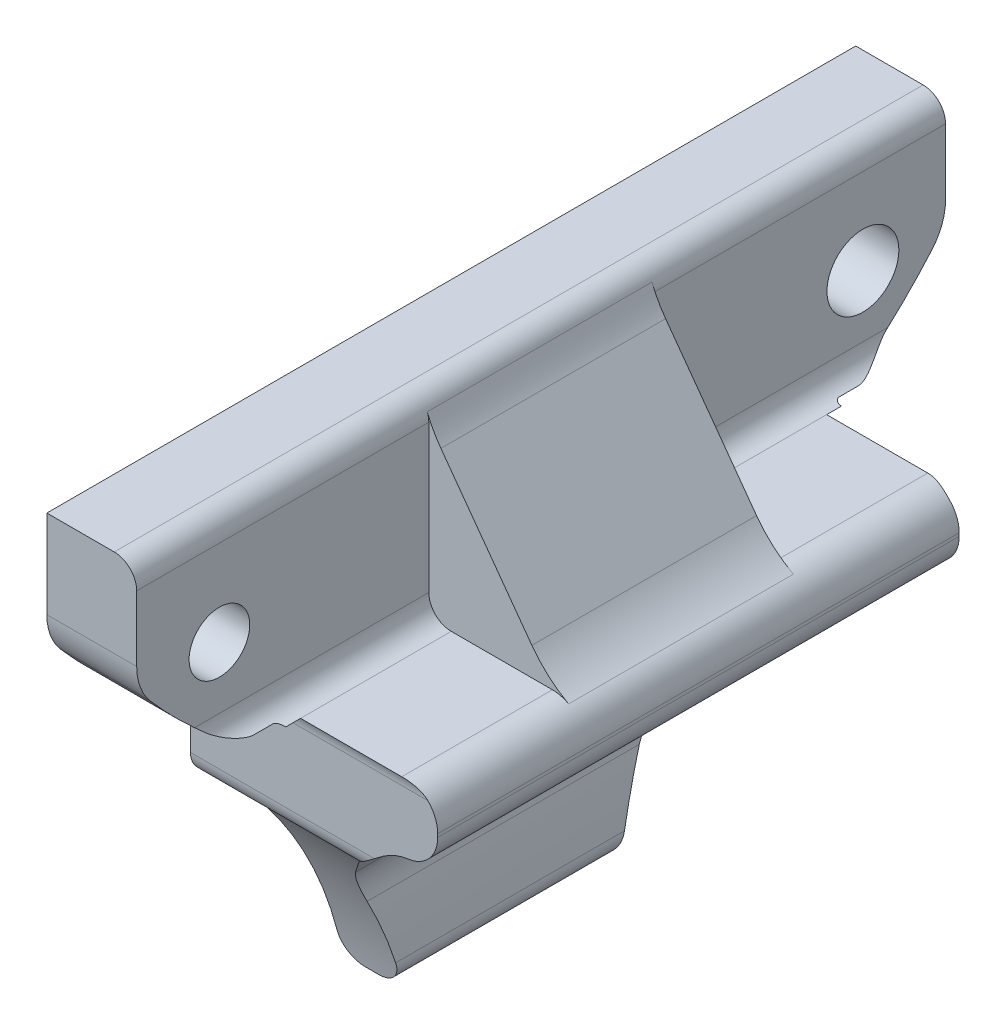
from build123d import *

# Parameters (mm, degrees)
EXTRUDE_1_DEPTH          = 4
EXTRUDE_START            = -4
SKETCH_3_W               = 23.208015554
SKETCH_3_H               = 15.560947598
EXTRUDE_2_DEPTH          = 4
SKETCH_7_W               = 7
SKETCH_7_H               = 15
EXTRUDE_3_DEPTH          = 23.208015554
CUT_EXTRUDE_6_DEPTH      = 25
SKETCH_5_R               = 1.35
SKETCH_5_R_2             = 1.6
CUT_EXTRUDE_2_DEPTH      = 41
FILLET_1_R               = 1
CUT_EXTRUDE_9_DEPTH      = 132.632440775
CUT_EXTRUDE_9_DEPTH_BACK = 132.632440775
SKETCH_16_R              = 17.5
EXTRUDE_5_DEPTH          = 4
FILLET_8_R               = 1
FILLET_10_R              = 1
FILLET_12_R              = 1
FILLET_13_R              = 1.5
RIB_1_REACH              = 137.852
SKETCH_19_WALL_W         = 283.05422189
SKETCH_19_WALL_H         = 10
FILLET_START             = -15.424467696
FILLET_14_DEPTH          = 30.848935392
FILLET_START_2           = -12.604007877
FILLET_14_2_DEPTH        = 25.208015654
FILLET_START_3           = -30.058809371
FILLET_14_3_DEPTH        = 2.058809371
FILLET_15_R              = 5


with BuildPart() as part:
    # 草图2 → 凸台-拉伸1 (new body)
    with BuildSketch(Plane(origin=(-34.058809371, 0, 0), x_dir=(0, 0, -1), z_dir=(1, 0, 0))):
        with BuildLine():
            Line((17.500319827, 130.276008038), (17.500319827, 126.359600173))
            ThreePointArc((17.500319827, 126.359600173), (17.374404969, 125.661169877), (17.012514948, 125.050682332))
            ThreePointArc((17.012514948, 125.050682332), (15.910222403, 123.866105461), (14.725645532, 122.763812916))
            ThreePointArc((14.725645532, 122.763812916), (14.115157987, 122.401922895), (13.416727692, 122.276008038))
            Line((13.416727692, 122.276008038), (8.570604361, 122.276008038))
            Line((8.570604361, 122.276008038), (-4.829395639, 122.276008038))
            Line((-4.829395639, 122.276008038), (-13.416088038, 122.276008038))
            ThreePointArc((-13.416088038, 122.276008038), (-14.114518334, 122.401922895), (-14.725005879, 122.763812916))
            ThreePointArc((-14.725005879, 122.763812916), (-15.90958275, 123.866105461), (-17.011875295, 125.050682332))
            ThreePointArc((-17.011875295, 125.050682332), (-17.373765316, 125.661169877), (-17.499680173, 126.359600173))
            Line((-17.499680173, 126.359600173), (-17.499680173, 130.276008038))
            Line((-17.499680173, 130.276008038), (17.500319827, 130.276008038))
        make_face()
    extrude(amount=EXTRUDE_1_DEPTH)

    # 草图3 → 凸台-拉伸2 (add)
    with BuildSketch(Plane(origin=(-30.058809371, 0, 0), x_dir=(0, 0, -1), z_dir=(1, 0, 0)).offset(EXTRUDE_START)):
        with Locations((0, 114.495534239)):
            Rectangle(SKETCH_3_W, SKETCH_3_H)
    extrude(amount=EXTRUDE_2_DEPTH)

    # 草图7 → 凸台-拉伸3 (add)
    with BuildSketch(Plane.XY.offset(11.604007777)):
        with Locations((-26.558809371, 114.21506044)):
            Rectangle(SKETCH_7_W, SKETCH_7_H)
    extrude(amount=-EXTRUDE_3_DEPTH)

    # 草图11 → 切除-拉伸6 (cut)
    with BuildSketch(Plane.XY.offset(11.604007777)):
        with BuildLine():
            Line((-17.260737948, 105.57071884), (-17.822335609, 118.157865003))
            ThreePointArc((-17.822335609, 118.157865003), (-20.746096987, 118.264862867), (-23.654216554, 118.585284033))
            ThreePointArc((-23.654216554, 118.585284033), (-24.615393694, 118.539747196), (-25.488172243, 118.134540208))
            ThreePointArc((-25.488172243, 118.134540208), (-28.620362377, 115.459397112), (-31.295505473, 112.327206978))
            ThreePointArc((-31.295505473, 112.327206978), (-31.700712461, 111.454428429), (-31.746249298, 110.493251289))
            ThreePointArc((-31.746249298, 110.493251289), (-31.523200675, 108.69967015), (-31.381401894, 106.897844106))
            ThreePointArc((-31.381401894, 106.897844106), (-31.32637065, 105.4380129), (-31.324682737, 103.977145782))
            Line((-31.324682737, 103.977145782), (-17.260737948, 105.57071884))
        make_face()
    extrude(amount=-CUT_EXTRUDE_6_DEPTH, mode=Mode.SUBTRACT)

    # 草图5 → 切除-拉伸2 (cut)
    with BuildSketch(Plane(origin=(-30.058809371, 0, 0), x_dir=(0, 0, -1), z_dir=(1, 0, 0))):
        with Locations(Location((-14.318592493, 125.457095719, 0), (0, 0, 90))):
            Circle(SKETCH_5_R)
        with Locations(Location((14.319232146, 125.457095719, 0), (0, 0, 90))):
            Circle(SKETCH_5_R_2)
    extrude(amount=-CUT_EXTRUDE_2_DEPTH, mode=Mode.SUBTRACT)

    # 圆角1
    fillet_1_edges = [part.edges().sort_by_distance(p)[0] for p in [
        (-32.058809371, 122.276008038, -11.604007777),
    ]]
    fillet(fillet_1_edges, radius=FILLET_1_R)
    fillet_1_2_edges = [part.edges().sort_by_distance(p)[0] for p in [
        (-32.058809371, 122.276008038, 11.604007777),
    ]]
    fillet(fillet_1_2_edges, radius=FILLET_1_R)

    # 草图16 → 切除-拉伸9 (cut, two sides: drawn at the far end of the back side and taken through both)
    with BuildSketch(Plane(origin=(-30.058809371, 0, 0), x_dir=(0, 0, -1), z_dir=(1, 0, 0)).offset(-CUT_EXTRUDE_9_DEPTH_BACK)):
        with Locations((22.000319827, 103.276008038)):
            Circle(SKETCH_16_R)
        with Locations((-21.999680173, 103.276008038)):
            Circle(SKETCH_16_R)
    extrude(amount=CUT_EXTRUDE_9_DEPTH + CUT_EXTRUDE_9_DEPTH_BACK, mode=Mode.SUBTRACT)

    # 草图17 → 凸台-拉伸5 (add)
    with BuildSketch(Plane(origin=(-30.058809371, 0, 0), x_dir=(0, 0, -1), z_dir=(1, 0, 0)).offset(EXTRUDE_START)):
        with BuildLine():
            Line((-12.604007777, 122.276008038), (-13.416088038, 122.276008038))
            ThreePointArc((-13.416088038, 122.276008038), (-14.114518334, 122.401922895), (-14.725005879, 122.763812916))
            ThreePointArc((-14.725005879, 122.763812916), (-15.90958275, 123.866105461), (-17.011875295, 125.050682332))
            ThreePointArc((-17.011875295, 125.050682332), (-17.373765316, 125.661169877), (-17.499680173, 126.359600173))
            Line((-17.499680173, 126.359600173), (-17.499680173, 130.276008038))
            Line((-17.499680173, 130.276008038), (-17.999680173, 130.276008038))
            Line((-17.999680173, 130.276008038), (-17.999680173, 129.776008038))
            Line((-17.999680173, 129.776008038), (-17.999680173, 126.359600173))
            ThreePointArc((-17.999680173, 126.359600173), (-17.842286602, 125.486562303), (-17.389924076, 124.723452872))
            ThreePointArc((-17.389924076, 124.723452872), (-16.263136141, 123.512552071), (-15.052235339, 122.385764135))
            ThreePointArc((-15.052235339, 122.385764135), (-14.289125908, 121.93340161), (-13.416088038, 121.776008038))
            Line((-13.416088038, 121.776008038), (-12.604007777, 121.776008038))
            ThreePointArc((-12.604007777, 121.776008038), (-12.48056994, 121.760531619), (-12.364773606, 121.71506044))
            Line((-12.364773606, 121.71506044), (-11.705546321, 121.71506044))
            ThreePointArc((-11.705546321, 121.71506044), (-12.074410006, 122.124256941), (-12.604007777, 122.276008038))
        make_face()
    extrude_5 = extrude(amount=EXTRUDE_5_DEPTH)

    # 镜向1: 凸台-拉伸5 across plane
    add(extrude_5.mirror(Plane.XY))

    # 圆角8
    fillet_8_edges = [part.edges().sort_by_distance(p)[0] for p in [
        (-30.284407251, 117.353177347, -11.604007777),
        (-30.284113568, 117.353649723, 11.604007777),
    ]]
    fillet(fillet_8_edges, radius=FILLET_8_R)

    # 圆角10
    fillet_10_edges = [part.edges().sort_by_distance(p)[0] for p in [
        (-30.058809371, 130.276008038, 0),
    ]]
    fillet(fillet_10_edges, radius=FILLET_10_R)

    # 圆角12
    fillet_12_edges = [part.edges().sort_by_distance(p)[0] for p in [
        (-31.371585595, 106.71506044, -0.000319827),
        (-34.058809371, 106.71506044, -0.000319827),
    ]]
    fillet(fillet_12_edges, radius=FILLET_12_R)

    # 圆角13
    fillet_13_edges = [part.edges().sort_by_distance(p)[0] for p in [
        (-23.058809371, 121.71506044, 0),
        (-23.058809371, 118.502104481, 0),
    ]]
    fillet(fillet_13_edges, radius=FILLET_13_R)

    # 草图19 wall → 筋1 (add, up to next)
    with BuildSketch(Plane(origin=(-27.308809371, 125.495534239, 0), x_dir=(0.588250674462, -0.808678640744, 0), z_dir=(0.808678640744, 0.588250674462, 0)), mode=Mode.PRIVATE) as rib_1_sk1:
        Rectangle(SKETCH_19_WALL_W, SKETCH_19_WALL_H)
    rib_1_tool1 = extrude(rib_1_sk1.sketch, amount=-RIB_1_REACH, mode=Mode.PRIVATE) - part.part
    add(rib_1_tool1.solids().sort_by_distance((-27.308809371, 125.495534239, 0))[0])

    # 圆角14: read off the stored shape, not the designer's step
    # 圆角14 outline → 圆角14 (add)
    with BuildSketch(Plane.XY.offset(FILLET_START)):
        with BuildLine():
            Line((-30.058809371, 121.776008038), (-29.402583406, 121.776008038))
            ThreePointArc((-29.402583406, 121.776008038), (-29.878496517, 122.142248968), (-30.058809371, 122.71506044))
            Line((-30.058809371, 122.71506044), (-30.058809371, 121.776008038))
        make_face()
    extrude(amount=FILLET_14_DEPTH)

    # Fillet 14 2 outline → Fillet 14 2 (add)
    with BuildSketch(Plane.XY.offset(FILLET_START_2)):
        with BuildLine():
            Line((-30.058809371, 121.71506044), (-29.058809371, 121.71506044))
            ThreePointArc((-29.058809371, 121.71506044), (-29.233376834, 121.730415224), (-29.402583406, 121.776008038))
            Line((-29.402583406, 121.776008038), (-30.058809371, 121.776008038))
            Line((-30.058809371, 121.776008038), (-30.058809371, 121.71506044))
        make_face()
    extrude(amount=FILLET_14_2_DEPTH)

    # Fillet 14 3 outline → Fillet 14 3 (cut)
    with BuildSketch(Plane.YZ.offset(FILLET_START_3)):
        with BuildLine():
            ThreePointArc((121.71506044, 12.364773606), (121.760531619, 12.48056994), (121.776008038, 12.604007777))
            Line((121.776008038, 12.604007777), (121.71506044, 12.604007777))
            Line((121.71506044, 12.604007777), (121.71506044, 12.364773606))
        make_face()
        with BuildLine():
            ThreePointArc((121.776008038, 13.416088038), (121.93340161, 14.289125908), (122.385764135, 15.052235339))
            ThreePointArc((122.385764135, 15.052235339), (122.549406884, 15.23924095), (122.715060489, 15.424467652))
            Line((122.715060489, 15.424467652), (121.776008038, 15.424467696))
            Line((121.776008038, 15.424467696), (121.776008038, 13.416088038))
        make_face()
        with BuildLine():
            ThreePointArc((122.385764135, -15.052235339), (121.93340161, -14.289125908), (121.776008038, -13.416088038))
            Line((121.776008038, -13.416088038), (121.776008038, -15.424467696))
            Line((121.776008038, -15.424467696), (122.715060489, -15.424467652))
            ThreePointArc((122.715060489, -15.424467652), (122.549406884, -15.23924095), (122.385764135, -15.052235339))
        make_face()
        with BuildLine():
            Line((121.71506044, -12.604007877), (121.776008038, -12.604007777))
            ThreePointArc((121.776008038, -12.604007777), (121.760531619, -12.48056994), (121.71506044, -12.364773606))
            Line((121.71506044, -12.364773606), (121.71506044, -12.604007877))
        make_face()
    extrude(amount=FILLET_14_3_DEPTH, mode=Mode.SUBTRACT)

    # 圆角15
    fillet_15_edges = [part.edges().sort_by_distance(p)[0] for p in [
        (-30.058809371, 129.276008038, 0),
        (-24.558809371, 121.71506044, 0),
    ]]
    fillet(fillet_15_edges, radius=FILLET_15_R)


solid = part.part
